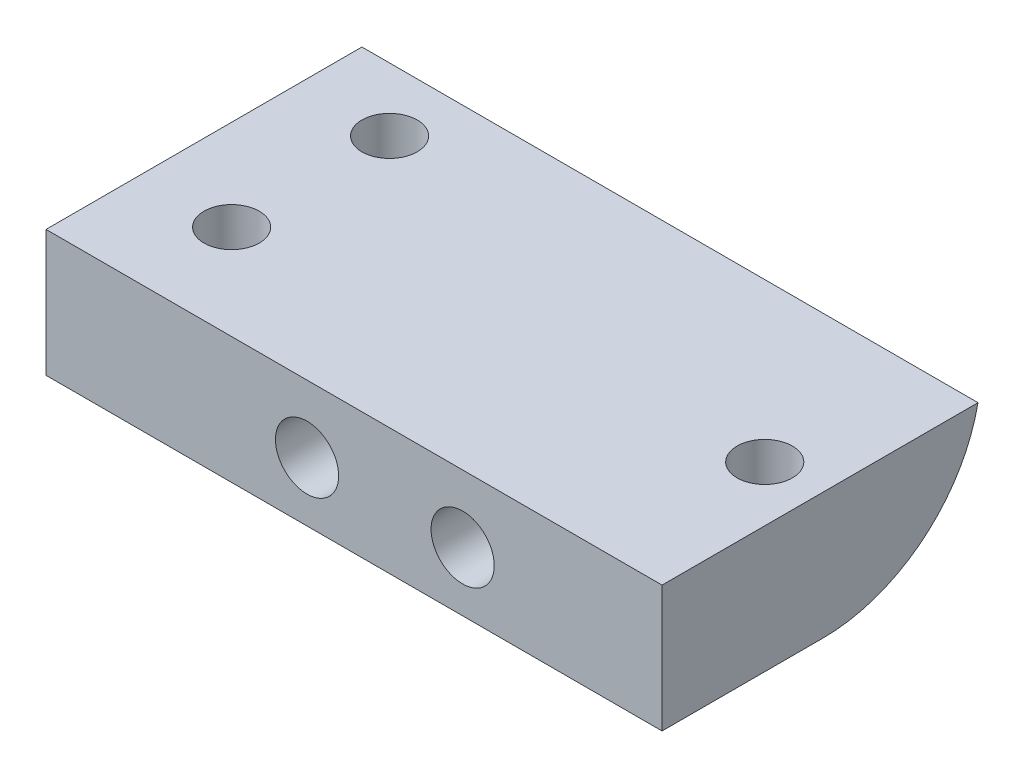
from build123d import *

# Parameters (mm, degrees)
SKETCH1_W           = 39
SKETCH1_H           = 8
SKETCH1_R           = 2
BOSS_EXTRUDE1_DEPTH = 20
CUT_EXTRUDE3_REACH  = 40.878
SKETCH2_R           = 1.75
FILLET1_R           = 10
SKETCH3_R           = 3.1
CUT_EXTRUDE4_DEPTH  = 4


with BuildPart() as part:
    # Sketch1 → Boss-Extrude1 (new body)
    with BuildSketch(Plane.XY):
        with Locations((12.864717907, 7.797867952)):
            Rectangle(SKETCH1_W, SKETCH1_H)
        with Locations((9.889717907, 7.547867952)):
            Circle(SKETCH1_R, mode=Mode.SUBTRACT)
        with Locations((19.739717907, 7.547867952)):
            Circle(SKETCH1_R, mode=Mode.SUBTRACT)
    extrude(amount=BOSS_EXTRUDE1_DEPTH)

    # Sketch2 → Cut-Extrude3 (cut, up to next)
    with BuildSketch(Plane(origin=(0, 11.797867952, 0), x_dir=(1, 0, 0), z_dir=(0, 1, 0)), mode=Mode.PRIVATE) as cut_extrude3_sk1:
        with Locations(Location((28.864717907, -10, 0), (0, 0, 270))):
            Circle(SKETCH2_R)
    cut_extrude3_tool1 = extrude(cut_extrude3_sk1.sketch, amount=-CUT_EXTRUDE3_REACH, mode=Mode.PRIVATE) & part.part
    # Sketch2 → Cut-Extrude3 (cut, up to next)
    with BuildSketch(Plane(origin=(0, 11.797867952, 0), x_dir=(1, 0, 0), z_dir=(0, 1, 0)), mode=Mode.PRIVATE) as cut_extrude3_sk2:
        with Locations(Location((-0.885282093, -14, 0), (0, 0, 270))):
            Circle(SKETCH2_R)
    cut_extrude3_tool2 = extrude(cut_extrude3_sk2.sketch, amount=-CUT_EXTRUDE3_REACH, mode=Mode.PRIVATE) & part.part
    # Sketch2 → Cut-Extrude3 (cut, up to next)
    with BuildSketch(Plane(origin=(0, 11.797867952, 0), x_dir=(1, 0, 0), z_dir=(0, 1, 0)), mode=Mode.PRIVATE) as cut_extrude3_sk3:
        with Locations(Location((-0.885282093, -4, 0), (0, 0, 270))):
            Circle(SKETCH2_R)
    cut_extrude3_tool3 = extrude(cut_extrude3_sk3.sketch, amount=-CUT_EXTRUDE3_REACH, mode=Mode.PRIVATE) & part.part
    add(cut_extrude3_tool1.solids().sort_by_distance((28.864718, 11.797868, 10))[0], mode=Mode.SUBTRACT)
    add(cut_extrude3_tool2.solids().sort_by_distance((-0.885282, 11.797868, 14))[0], mode=Mode.SUBTRACT)
    add(cut_extrude3_tool3.solids().sort_by_distance((-0.885282, 11.797868, 4))[0], mode=Mode.SUBTRACT)

    # Fillet1
    # the kernel refuses this fillet: 10 mm, written as the material it takes off along each edge
    with BuildSketch(Plane(origin=(56.859615335, 3.797867952, 0), x_dir=(0, 1, 0), z_dir=(-1, 0, 0))) as fillet1_piece_1:
        with BuildLine():
            CenterArc((10, -9.797958971), FILLET1_R, 101.536959033, 78.463040967)
            Line((0, -9.797958971), (-0.2, -9.797958971))
            Line((-0.2, -9.797958971), (-0.2, 0))
            Line((-0.2, 0), (0, 0.2))
            ThreePointArc((0, 0.2), (4, 0.2), (7.96, 0.195959179))
            Line((7.96, 0.195959179), (8, 0))
        make_face()
    extrude(amount=87.989794856, mode=Mode.SUBTRACT)

    # Sketch3 → Cut-Extrude4 (cut)
    with BuildSketch(Plane.XZ.offset(-3.797867952)):
        with Locations(Location((-0.885282093, 14, 0), (0, 0, 270))):
            Circle(SKETCH3_R)
        with Locations(Location((28.864717907, 10, 0), (0, 0, 270))):
            Circle(SKETCH3_R)
        with Locations((-0.885282093, 4)):
            Circle(SKETCH3_R)
    extrude(amount=-CUT_EXTRUDE4_DEPTH, mode=Mode.SUBTRACT)


solid = part.part
